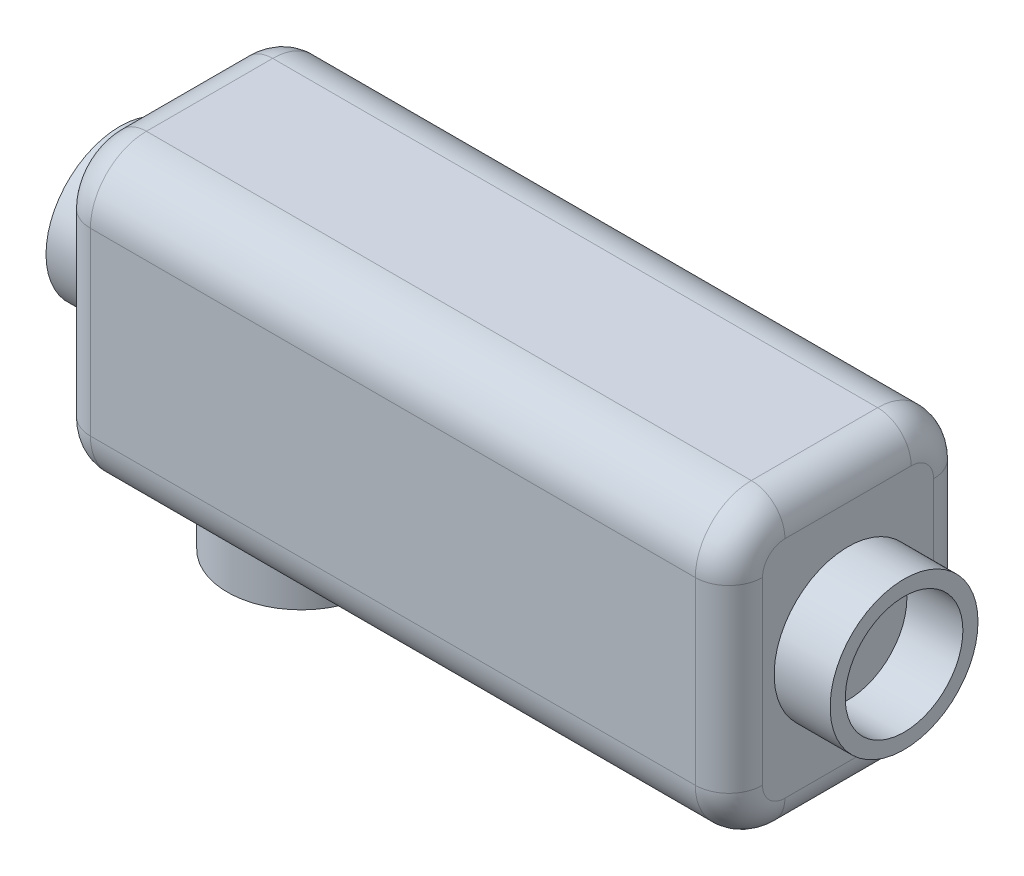
from build123d import *

# Parameters (mm, degrees)
SKETCH1_R           = 16.764
SKETCH1_R_2         = 13.335
BOSS_EXTRUDE1_DEPTH = 12.7
SKETCH2_W           = 54.028772228
SKETCH2_H           = 66.192828526
BOSS_EXTRUDE2_DEPTH = 152.4
FILLET1_R           = 7.62
FILLET2_R           = 12.7
FILLET3_R           = 12.7
FILLET4_R           = 7.62
BOSS_EXTRUDE3_START = 12.7
SKETCH3_R           = 16.764
SKETCH3_R_2         = 13.335
BOSS_EXTRUDE3_DEPTH = 12.7
SKETCH4_R           = 16.764
SKETCH4_R_2         = 13.335
BOSS_EXTRUDE4_DEPTH = 12.7
BOSS_EXTRUDE5_DEPTH = 2.54


with BuildPart() as part:
    # Sketch1 → Boss-Extrude1 (new body)
    with BuildSketch(Plane(origin=(0, 0, 0), x_dir=(0, 0, -1), z_dir=(1, 0, 0))):
        Circle(SKETCH1_R)
        Circle(SKETCH1_R_2, mode=Mode.SUBTRACT)
    extrude(amount=BOSS_EXTRUDE1_DEPTH)

    # Sketch2 → Boss-Extrude2 (add)
    with BuildSketch(Plane.ZY):
        Rectangle(SKETCH2_W, SKETCH2_H)
    extrude(amount=BOSS_EXTRUDE2_DEPTH)

    # Fillet1
    fillet1_edges = [part.edges().sort_by_distance(p)[0] for p in [
        (0, 33.096414263, 0),
        (0, 0, -27.014386114),
        (0, -33.096414263, 0),
        (0, 0, 27.014386114),
    ]]
    fillet(fillet1_edges, radius=FILLET1_R)

    # Fillet2
    # the kernel refuses this fillet: 12.7 mm, written as the material it takes off along each edge
    with BuildSketch(Plane(origin=(0, -20.396414263, -14.314386114), x_dir=(0, -1, 0), z_dir=(0, 0, 1))) as fillet2_piece_1:
        with BuildLine():
            CenterArc((5.08, -7.62), 7.62, 0, 90)
            Line((12.7, -7.62), (12.7, 0))
            Line((12.7, 0), (5.08, 0))
        make_face()
    revolve(axis=Axis((0, -20.396414263, -14.314386114), (1, 0, 0)), revolution_arc=90, mode=Mode.SUBTRACT)
    with BuildSketch(Plane(origin=(0, 20.396414263, -14.314386114), x_dir=(0, 0, -1), z_dir=(0, -1, 0))) as fillet2_piece_2:
        with BuildLine():
            CenterArc((5.08, -7.62), 7.62, 0, 90)
            Line((12.7, -7.62), (12.7, 0))
            Line((12.7, 0), (5.08, 0))
        make_face()
    revolve(axis=Axis((0, 20.396414263, -14.314386114), (1, 0, 0)), revolution_arc=90, mode=Mode.SUBTRACT)
    with BuildSketch(Plane(origin=(0, 20.396414263, 14.314386114), x_dir=(0, 1, 0), z_dir=(0, 0, -1))) as fillet2_piece_3:
        with BuildLine():
            CenterArc((5.08, -7.62), 7.62, 0, 90)
            Line((12.7, -7.62), (12.7, 0))
            Line((12.7, 0), (5.08, 0))
        make_face()
    revolve(axis=Axis((0, 20.396414263, 14.314386114), (1, 0, 0)), revolution_arc=90, mode=Mode.SUBTRACT)
    with BuildSketch(Plane(origin=(0, 33.096414263, 27.014386114), x_dir=(0, -1, 0), z_dir=(-1, 0, 0))) as fillet2_piece_4:
        with BuildLine():
            CenterArc((FILLET2_R, -FILLET2_R), FILLET2_R, 90, 90)
            Line((0, -FILLET2_R), (0, 0))
            Line((0, 0), (FILLET2_R, 0))
        make_face()
    extrude(amount=184.15, mode=Mode.SUBTRACT)
    with BuildSketch(Plane(origin=(0, 33.096414263, -27.014386114), x_dir=(0, -1, 0), z_dir=(-1, 0, 0)), Plane(origin=(0, -33.096414263, -27.014386114), x_dir=(0, 0, 1), z_dir=(-1, 0, 0))) as fillet2_piece_5:
        with BuildLine():
            CenterArc((FILLET2_R, FILLET2_R), FILLET2_R, 180, 90)
            Line((0, FILLET2_R), (0, 0))
            Line((0, 0), (FILLET2_R, 0))
        make_face()
    extrude(amount=184.15, mode=Mode.SUBTRACT)

    # Fillet3
    # the kernel refuses this fillet: 12.7 mm, written as the material it takes off along each edge
    with BuildSketch(Plane(origin=(0, -20.396414263, 14.314386114), x_dir=(0, 0, 1), z_dir=(0, 1, 0))) as fillet3_piece_1:
        with BuildLine():
            CenterArc((5.08, -7.62), 7.62, 0, 90)
            Line((12.7, -7.62), (12.7, 0))
            Line((12.7, 0), (5.08, 0))
        make_face()
    revolve(axis=Axis((0, -20.396414263, 14.314386114), (1, 0, 0)), revolution_arc=90, mode=Mode.SUBTRACT)
    with BuildSketch(Plane(origin=(0, -33.096414263, 27.014386114), x_dir=(0, 0, -1), z_dir=(-1, 0, 0))) as fillet3_piece_2:
        with BuildLine():
            CenterArc((FILLET3_R, -FILLET3_R), FILLET3_R, 90, 90)
            Line((0, -FILLET3_R), (0, 0))
            Line((0, 0), (FILLET3_R, 0))
        make_face()
    extrude(amount=184.15, mode=Mode.SUBTRACT)

    # Fillet4
    fillet4_edges = [part.edges().sort_by_distance(p)[0] for p in [
        (-152.4, -33.096414263, 0),
        (-152.4, 0, -27.014386114),
        (-152.4, 33.096414263, 0),
        (-152.4, 29.376670384, -23.294642235),
        (-152.4, 29.376670384, 23.294642235),
        (-152.4, -29.376670384, -23.294642235),
        (-152.4, 0, 27.014386114),
        (-152.4, -29.376670384, 23.294642235),
    ]]
    fillet(fillet4_edges, radius=FILLET4_R)

    # Sketch3 → Boss-Extrude3 (add)
    with BuildSketch(Plane.ZY.offset(152.4).offset(BOSS_EXTRUDE3_START)):
        with Locations(Location((0, 0, 0), (0, 0, 180))):
            Circle(SKETCH3_R)
        with Locations(Location((0, 0, 0), (0, 0, 180))):
            Circle(SKETCH3_R_2, mode=Mode.SUBTRACT)
    extrude(amount=-BOSS_EXTRUDE3_DEPTH)

    # Sketch4 → Boss-Extrude4 (add)
    with BuildSketch(Plane.XZ.offset(33.096414263)):
        with Locations(Location((-123.986445469, 0, 0), (0, 0, 58.635839184))):
            Circle(SKETCH4_R)
        with Locations(Location((-123.986445469, 0, 0), (0, 0, 270))):
            Circle(SKETCH4_R_2, mode=Mode.SUBTRACT)
    extrude(amount=BOSS_EXTRUDE4_DEPTH)

    # Sketch5 → Boss-Extrude5 (add)
    with BuildSketch(Plane(origin=(0, 0, -27.014386114), x_dir=(-1, 0, 0), z_dir=(0, 0, -1))):
        Polygon((53.996659103, 0), (87.835708054, 0), (87.835708054, 6.35), (96.484197887, -3.175), (87.835708054, -12.7), (87.835708054, -6.35), (53.996659103, -6.35), align=None)
    extrude(amount=BOSS_EXTRUDE5_DEPTH)


solid = part.part
